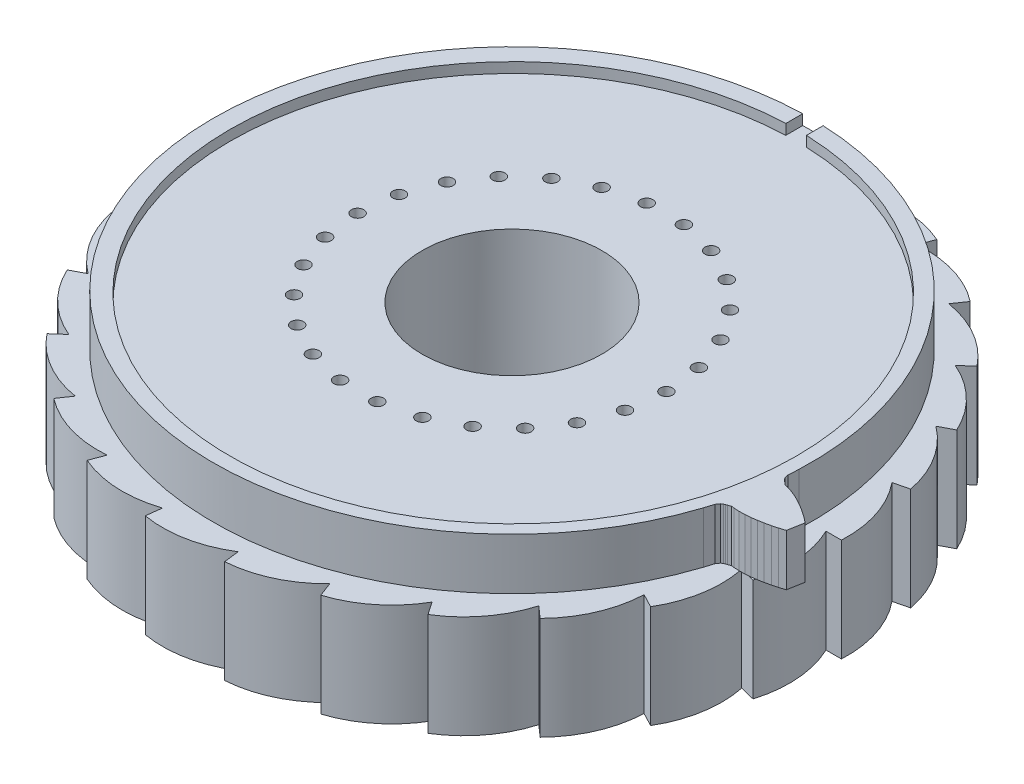
from build123d import *

# Parameters (mm, degrees)
EXTRUDE_RATCHET_EDGE_DEPTH      = 10
PATTERN_EDGE_TO_FORM_GEAR_COUNT = 26
GEAR_FACE_DEPTH                 = 5
PCB_INSET_DEPTH                 = 1
SKETCH7_R                       = 8.73125
CUT_BEARING_HOLE_DEPTH          = 49.842539577
PCB_INSET_REAR_DEPTH            = 1
PIN_HOLES_R                     = 0.6
PIN_HOLES_CUT_DEPTH             = 49.544759473


with BuildPart() as part:
    # Sketch1 → Extrude ratchet edge (new body)
    with BuildSketch(Plane(origin=(0, 0, 0), x_dir=(1, 0, 0), z_dir=(0, 1, 0))):
        with BuildLine():
            Line((0, 0), (29.613725431, 7.299127761))
            ThreePointArc((29.613725431, 7.299127761), (31.486736206, 3.871832194), (32, 0))
            Line((32, 0), (0, 0))
        make_face()
    extrude_ratchet_edge = extrude(amount=EXTRUDE_RATCHET_EDGE_DEPTH)

    # Pattern edge to form gear: Extrude ratchet edge ×26 about axis
    pattern_edge_to_form_gear_axis = Axis((0, 10, 0), (0, -1, 0))
    for i in range(1, PATTERN_EDGE_TO_FORM_GEAR_COUNT):
        add(extrude_ratchet_edge.rotate(pattern_edge_to_form_gear_axis, i * 360 / PATTERN_EDGE_TO_FORM_GEAR_COUNT))

    # Sketch12 → Gear face (add)
    with BuildSketch(Plane(origin=(0, 10, 0), x_dir=(1, 0, 0), z_dir=(0, 1, 0))):
        with BuildLine():
            Line((28.927375325, -2.125741727), (29.026395325, -2.515151727))
            Line((29.026395325, -2.515151727), (29.142735325, -2.671831727))
            Line((29.142735325, -2.671831727), (29.262305325, -2.787261727))
            Line((29.262305325, -2.787261727), (29.383725325, -2.880131727))
            Line((29.383725325, -2.880131727), (29.624225325, -3.082071727))
            Line((29.624225325, -3.082071727), (29.879175325, -3.139941727))
            Line((29.879175325, -3.139941727), (30.384275325, -3.299211727))
            Line((30.384275325, -3.299211727), (30.884385325, -3.499611727))
            Line((30.884385325, -3.499611727), (31.379885325, -3.733371727))
            Line((31.379885325, -3.733371727), (31.870755325, -3.996551727))
            Line((31.870755325, -3.996551727), (32.356805325, -4.286661727))
            Line((32.356805325, -4.286661727), (32.837785325, -4.602001727))
            Line((32.837785325, -4.602001727), (33.313375325, -4.941291727))
            Line((33.313375325, -4.941291727), (33.783255325, -5.303521727))
            Line((33.783255325, -5.303521727), (33.502035325, -6.859281727))
            Line((33.502035325, -6.859281727), (32.935085325, -7.034091727))
            Line((32.935085325, -7.034091727), (32.370805325, -7.185411727))
            Line((32.370805325, -7.185411727), (31.809875325, -7.312411727))
            Line((31.809875325, -7.312411727), (31.253015325, -7.414011727))
            Line((31.253015325, -7.414011727), (30.701075325, -7.488691727))
            Line((30.701075325, -7.488691727), (30.155095325, -7.534201727))
            Line((30.155095325, -7.534201727), (29.616475325, -7.546831727))
            Line((29.616475325, -7.546831727), (29.087575325, -7.519191727))
            Line((29.087575325, -7.519191727), (28.828505325, -7.484151727))
            Line((28.828505325, -7.484151727), (28.532525325, -7.589111727))
            Line((28.532525325, -7.589111727), (28.386275325, -7.633601727))
            Line((28.386275325, -7.633601727), (28.233865325, -7.699871727))
            Line((28.233865325, -7.699871727), (28.070045325, -7.805911727))
            Line((28.070045325, -7.805911727), (27.840955325, -8.136001727))
            Line((27.840955325, -8.136001727), (27.578045325, -8.986971727))
            ThreePointArc((27.578045325, -8.986971727), (-28.554449146, 5.09486788), (28.984351964, -1.105253821))
            Line((28.984351964, -1.105253821), (28.927375325, -2.125741727))
        make_face()
    extrude(amount=GEAR_FACE_DEPTH)

    # Sketch10 → PCB inset (cut)
    with BuildSketch(Plane(origin=(0, 15, 0), x_dir=(1, 0, 0), z_dir=(0, 1, 0))):
        with BuildLine():
            Line((-0.753755436, 29.351723584), (-0.753755436, 27.351723584))
            ThreePointArc((-0.753755436, 27.351723584), (0.246244564, -27.630088583), (1.246244564, 27.351723584))
            Line((1.246244564, 27.351723584), (1.246244564, 29.351723584))
            Line((1.246244564, 29.351723584), (-0.753755436, 29.351723584))
        make_face()
    extrude(amount=-PCB_INSET_DEPTH, mode=Mode.SUBTRACT)

    # Sketch7 → Cut bearing hole (cut, through all)
    with BuildSketch(Plane(origin=(0, 15, 0), x_dir=(1, 0, 0), z_dir=(0, 1, 0))):
        Circle(SKETCH7_R)
    extrude(amount=-CUT_BEARING_HOLE_DEPTH, mode=Mode.SUBTRACT)

    # Sketch11 → PCB inset rear (cut)
    with BuildSketch(Plane.XZ):
        with BuildLine():
            Line((1, -29.481812167), (1, -27.481812167))
            ThreePointArc((1, -27.481812167), (0, 27.5), (-1, -27.481812167))
            Line((-1, -27.481812167), (-1, -29.481812167))
            Line((-1, -29.481812167), (1, -29.481812167))
        make_face()
    extrude(amount=-PCB_INSET_REAR_DEPTH, mode=Mode.SUBTRACT)

    # pin holes → Pin holes cut (cut, through all)
    with BuildSketch(Plane(origin=(0, 14, 0), x_dir=(1, 0, 0), z_dir=(0, 1, 0))):
        with Locations((15, 0)):
            Circle(PIN_HOLES_R)
        with Locations((14.564127261, -3.589734964)):
            Circle(PIN_HOLES_R)
        with Locations((13.281840385, -6.970847581)):
            Circle(PIN_HOLES_R)
        with Locations((11.227661223, -9.946839874)):
            Circle(PIN_HOLES_R)
        with Locations((8.520971201, -12.344757988)):
            Circle(PIN_HOLES_R)
        with Locations((5.319073306, -14.02524364)):
            Circle(PIN_HOLES_R)
        with Locations((1.808050204, -14.890633111)):
            Circle(PIN_HOLES_R)
        with Locations((-1.808050204, -14.890633111)):
            Circle(PIN_HOLES_R)
        with Locations((-5.319073306, -14.02524364)):
            Circle(PIN_HOLES_R)
        with Locations((-8.520971201, -12.344757988)):
            Circle(PIN_HOLES_R)
        with Locations((-11.227661223, -9.946839874)):
            Circle(PIN_HOLES_R)
        with Locations((-13.281840385, -6.970847581)):
            Circle(PIN_HOLES_R)
        with Locations((-14.564127261, -3.589734964)):
            Circle(PIN_HOLES_R)
        with Locations((-15, 0)):
            Circle(PIN_HOLES_R)
        with Locations((-14.564127261, 3.589734964)):
            Circle(PIN_HOLES_R)
        with Locations((-13.281840385, 6.970847581)):
            Circle(PIN_HOLES_R)
        with Locations((-11.227661223, 9.946839874)):
            Circle(PIN_HOLES_R)
        with Locations((-8.520971201, 12.344757988)):
            Circle(PIN_HOLES_R)
        with Locations((-5.319073306, 14.02524364)):
            Circle(PIN_HOLES_R)
        with Locations((-1.808050204, 14.890633111)):
            Circle(PIN_HOLES_R)
        with Locations((1.808050204, 14.890633111)):
            Circle(PIN_HOLES_R)
        with Locations((5.319073306, 14.02524364)):
            Circle(PIN_HOLES_R)
        with Locations((8.520971201, 12.344757988)):
            Circle(PIN_HOLES_R)
        with Locations((11.227661223, 9.946839874)):
            Circle(PIN_HOLES_R)
        with Locations((13.281840385, 6.970847581)):
            Circle(PIN_HOLES_R)
        with Locations((14.564127261, 3.589734964)):
            Circle(PIN_HOLES_R)
    extrude(amount=-PIN_HOLES_CUT_DEPTH, mode=Mode.SUBTRACT)


solid = part.part
